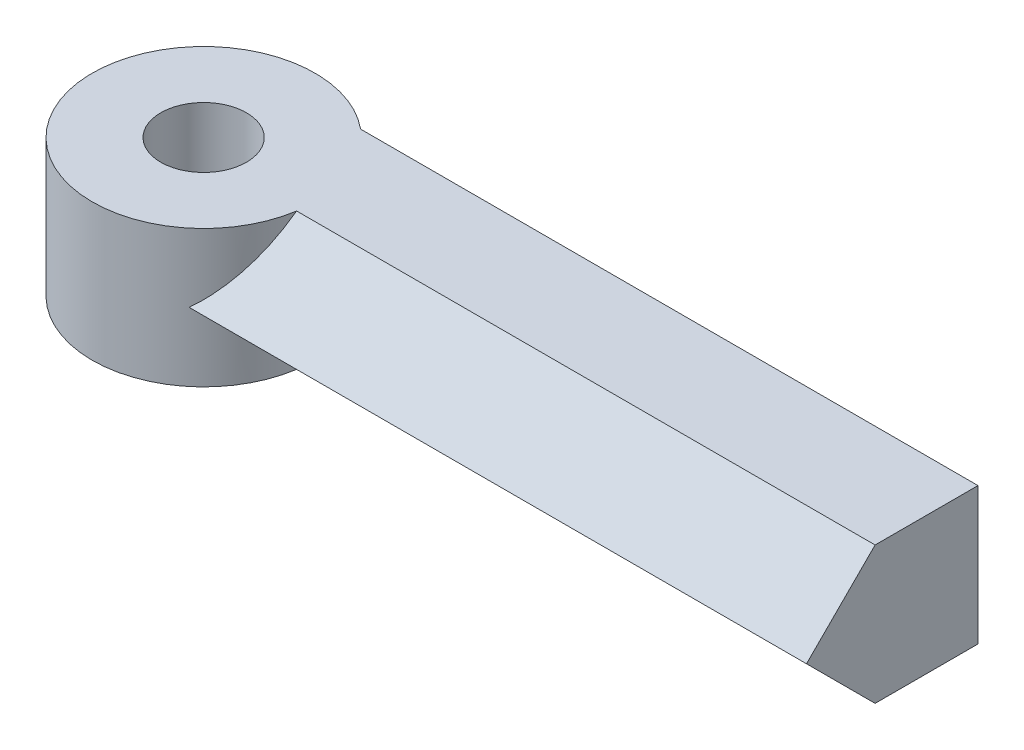
from build123d import *

# Parameters (mm, degrees)
CROQUIS1_R              = 3.25
CROQUIS1_R_2            = 1.25
SALIENTE_EXTRUIR1_DEPTH = 4
CROQUIS2_W              = 18
CROQUIS2_H              = 5
SALIENTE_EXTRUIR2_DEPTH = 4
CHAFL_N1_SIZE           = 2


with BuildPart() as part:
    # Croquis1 → Saliente-Extruir1 (new body)
    with BuildSketch(Plane(origin=(0, 0, 0), x_dir=(1, 0, 0), z_dir=(0, 1, 0))):
        with Locations(Location((0, 0, 0), (0, 0, 270))):
            Circle(CROQUIS1_R)
        with Locations(Location((0, 0, 0), (0, 0, 270))):
            Circle(CROQUIS1_R_2, mode=Mode.SUBTRACT)
    extrude(amount=SALIENTE_EXTRUIR1_DEPTH)

    # Croquis2 → Saliente-Extruir2 (add)
    with BuildSketch(Plane(origin=(0, 4, 0), x_dir=(1, 0, 0), z_dir=(0, 1, 0))):
        with Locations((11.076655966, 0)):
            Rectangle(CROQUIS2_W, CROQUIS2_H)
    extrude(amount=-SALIENTE_EXTRUIR2_DEPTH)

    # Chaflán1
    chafl_n1_edges = [part.edges().sort_by_distance(p)[0] for p in [
        (11.076655966, 4, 2.5),
        (11.076655966, 0, 2.5),
    ]]
    chamfer(chafl_n1_edges, length=CHAFL_N1_SIZE - 0.0001)  # a hair under: the kernel refuses the full size


solid = part.part
